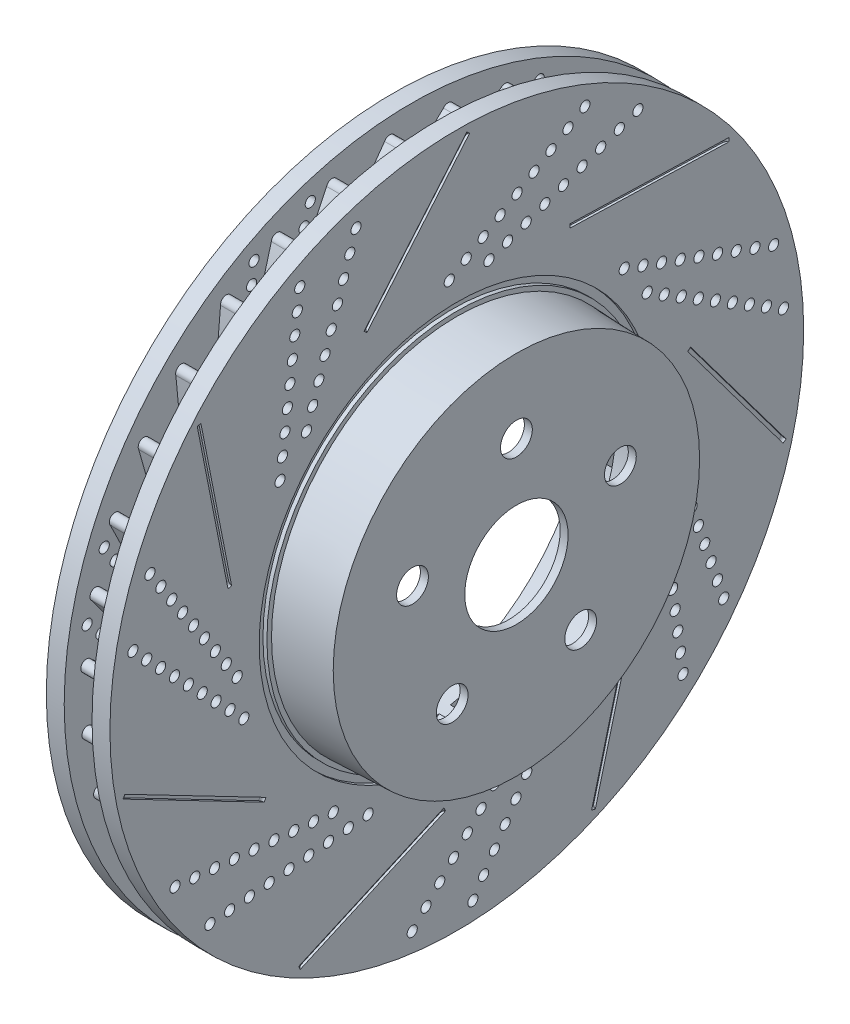
from build123d import *

# Parameters (mm, degrees)
SKETCH1_R                = 87.27
BOSS_EXTRUDE1_DEPTH      = 4.5
SKETCH2_R                = 49.72
CUT_EXTRUDE1_DEPTH       = 4.5
SKETCH3_R                = 1.28
CUT_EXTRUDE2_DEPTH       = 4.5
CIRPATTERN1_COUNT        = 7
CUT_EXTRUDE3_DEPTH       = 0.6
FILLET1_R                = 1
CIRPATTERN2_COUNT        = 7
FILLET1_OF_CIRPATTERN2_R = 1
BOSS_EXTRUDE2_START      = 7
BOSS_EXTRUDE2_DEPTH      = 7
SKETCH9_R                = 13
SKETCH9_R_2              = 4
CUT_EXTRUDE4_DEPTH       = 4.6
SCALE1_SCALE             = 2


with BuildPart() as part:
    # Sketch1 → Boss-Extrude1 (new body)
    with BuildSketch(Plane(origin=(0, 0, 0), x_dir=(0, 0, -1), z_dir=(1, 0, 0))):
        Circle(SKETCH1_R)
    extrude(amount=BOSS_EXTRUDE1_DEPTH)

    # Sketch2 → Cut-Extrude1 (cut)
    with BuildSketch(Plane(origin=(4.5, 0, 0), x_dir=(0, 0, -1), z_dir=(1, 0, 0))):
        Circle(SKETCH2_R)
    extrude(amount=-CUT_EXTRUDE1_DEPTH, mode=Mode.SUBTRACT)

    # Sketch3 → Cut-Extrude2 (cut)
    with BuildSketch(Plane(origin=(4.5, 0, 0), x_dir=(0, 0, -1), z_dir=(1, 0, 0))):
        with Locations((-22.32, -50.721196999)):
            Circle(SKETCH3_R)
        with Locations((-31.072217933, -45.883978661)):
            Circle(SKETCH3_R)
        with Locations((-27.295191101, -51.21866409)):
            Circle(SKETCH3_R)
        with Locations((-32.270382202, -51.716131181)):
            Circle(SKETCH3_R)
        with Locations((-37.245573304, -52.213598272)):
            Circle(SKETCH3_R)
        with Locations((-42.220764405, -52.711065363)):
            Circle(SKETCH3_R)
        with Locations((-47.195955506, -53.208532454)):
            Circle(SKETCH3_R)
        with Locations((-52.171146607, -53.705999545)):
            Circle(SKETCH3_R)
        with Locations((-57.146337708, -54.203466636)):
            Circle(SKETCH3_R)
        with Locations((-62.12152881, -54.700933726)):
            Circle(SKETCH3_R)
        with Locations((-36.050921957, -45.422994664)):
            Circle(SKETCH3_R)
        with Locations((-41.02962598, -44.962010668)):
            Circle(SKETCH3_R)
        with Locations((-46.008330004, -44.501026671)):
            Circle(SKETCH3_R)
        with Locations((-50.987034028, -44.040042675)):
            Circle(SKETCH3_R)
        with Locations((-55.965738051, -43.579058678)):
            Circle(SKETCH3_R)
        with Locations((-60.944442075, -43.118074682)):
            Circle(SKETCH3_R)
        with Locations((-65.923146098, -42.657090685)):
            Circle(SKETCH3_R)
        with Locations((-70.901850122, -42.196106689)):
            Circle(SKETCH3_R)
    cut_extrude2 = extrude(amount=-CUT_EXTRUDE2_DEPTH, mode=Mode.SUBTRACT)

    # CirPattern1: Cut-Extrude2 ×7 about axis
    cirpattern1_axis = Axis((0, 0, 0), (1, 0, 0))
    for i in range(1, CIRPATTERN1_COUNT):
        add(cut_extrude2.rotate(cirpattern1_axis, i * 360 / CIRPATTERN1_COUNT), mode=Mode.SUBTRACT)

    # Sketch4 → Cut-Extrude3 (cut)
    with BuildSketch(Plane(origin=(4.5, 0, 0), x_dir=(0, 0, -1), z_dir=(1, 0, 0))):
        Polygon((-3.222332444, -58.840115094), (-2.84, -59.698847824), (-39.381818306, -75.968313547), (-39.76415075, -75.109580817), align=None)
    cut_extrude3 = extrude(amount=-CUT_EXTRUDE3_DEPTH, mode=Mode.SUBTRACT)

    # Fillet1
    # the kernel refuses this fillet: 1 mm, written as the material it adds along each edge
    with BuildSketch(Plane(origin=(3.9, -56.746919489, 4.154283172), x_dir=(1, 0, 0), z_dir=(0, -0.9135454576426023, -0.40673664307579704)), Plane(origin=(3.9, -78.061509153, 38.449867578), x_dir=(1, 0, 0), z_dir=(0, 0.9135454576426025, 0.40673664307579666))) as fillet1_piece_1:
        with BuildLine():
            CenterArc((1, 0.916515139), FILLET1_R, 180, 66.421821522)
            Line((0, 0.916515139), (-0.02, 0.916515139))
            Line((-0.02, 0.916515139), (-0.02, 0))
            Line((-0.02, 0), (0, -0.02))
            ThreePointArc((0, -0.02), (0.3, -0.02), (0.592, -0.018330303))
            Line((0.592, -0.018330303), (0.6, 0))
        make_face()
    extrude(amount=5.522575695)

    # CirPattern2: Cut-Extrude3 ×7 about axis
    cirpattern2_axis = Axis((0, 0, 0), (1, 0, 0))
    for i in range(1, CIRPATTERN2_COUNT):
        add(cut_extrude3.rotate(cirpattern2_axis, i * 360 / CIRPATTERN2_COUNT), mode=Mode.SUBTRACT)

    # Fillet1 of CirPattern2
    # the kernel refuses this fillet: 1 mm, written as the material it adds along each edge
    with BuildSketch(Plane(origin=(3.9, -38.629074959, -41.776374998), x_dir=(1, 0, 0), z_dir=(0, -0.251586763744512, -0.9678347484506656)), Plane(origin=(3.9, -78.731871844, -37.057845107), x_dir=(1, 0, 0), z_dir=(0, 0.25158676374451233, 0.9678347484506655)), Plane(origin=(3.9, 8.577250904, -56.248570711), x_dir=(1, 0, 0), z_dir=(0, 0.5998218946879109, -0.8001335480112084)), Plane(origin=(3.9, -20.115529199, -84.660244584), x_dir=(1, 0, 0), z_dir=(0, -0.5998218946879105, 0.8001335480112088)), Plane(origin=(3.9, 49.324731893, -28.364445418), x_dir=(1, 0, 0), z_dir=(0, 0.9995524322835033, -0.029915466169402057)), Plane(origin=(3.9, 53.648217214, -68.511753135), x_dir=(1, 0, 0), z_dir=(0, -0.9995524322835032, 0.029915466169402497)), Plane(origin=(3.9, 52.929683725, 20.878685805), x_dir=(1, 0, 0), z_dir=(0, 0.6465996012158023, 0.7628295718622643)), Plane(origin=(3.9, 87.013761841, -0.772514191), x_dir=(1, 0, 0), z_dir=(0, -0.6465996012158027, -0.762829571862264)), Plane(origin=(3.9, 16.677504143, 54.399740769), x_dir=(1, 0, 0), z_dir=(0, -0.1932559177955506, 0.9811483833941732)), Plane(origin=(3.9, 54.856169044, 67.548443696), x_dir=(1, 0, 0), z_dir=(0, 0.19325591779555018, -0.9811483833941733)), Plane(origin=(3.9, -32.133176217, 46.956681381), x_dir=(1, 0, 0), z_dir=(0, -0.8875857890045524, 0.46064245045063557)), Plane(origin=(3.9, -18.609237905, 85.004045742), x_dir=(1, 0, 0), z_dir=(0, 0.8875857890045522, -0.460642450450636))) as fillet1_of_cirpattern2_piece_1:
        with BuildLine():
            CenterArc((1, 0.916515139), FILLET1_OF_CIRPATTERN2_R, 180, 66.421821522)
            Line((0, 0.916515139), (-0.02, 0.916515139))
            Line((-0.02, 0.916515139), (-0.02, 0))
            Line((-0.02, 0), (0, -0.02))
            ThreePointArc((0, -0.02), (0.3, -0.02), (0.592, -0.018330303))
            Line((0.592, -0.018330303), (0.6, 0))
        make_face()
    extrude(amount=5.522575695)


with BuildPart() as body_2:
    # Mirror2: mirrored copy
    add(part.part.mirror(Plane.ZY.offset(3.5)))


with BuildPart() as part_1:
    add(part.part)

    add(body_2.part)  # Boss-Extrude2 merges body 2
    # Sketch6 → Boss-Extrude2 (add)
    with BuildSketch(Plane(origin=(-7, 0, 0), x_dir=(0, 0, -1), z_dir=(1, 0, 0)).offset(BOSS_EXTRUDE2_START)):
        with BuildLine():
            ThreePointArc((-65.408487578, -48.075985448), (-66.633737197, -49.682988582), (-65.026734063, -50.9082382))
            add(Edge.make_bspline(
                [(-16.507092101, -46.899832733), (-40.460677436, -52.432931171), (-65.026734063, -50.9082382)],
                knots=[0, 0, 0, 1, 1, 1], degree=2))
            ThreePointArc((-16.507092101, -46.899832733), (-17.860913713, -46.401143966), (-19.199696195, -45.863384808))
            add(Edge.make_bspline(
                [(-19.199696195, -45.863384808), (-36.541787122, -49.271282557), (-43.651321864, -48.455688055), (-65.408487578, -48.075985448)],
                knots=[0, 0, 0, 0, 1, 1, 1, 1], degree=3))
        make_face()
        with BuildLine():
            ThreePointArc((-72.94164495, -35.624248148), (-74.434145792, -36.986649313), (-73.071744627, -38.479150155))
            add(Edge.make_bspline(
                [(-24.616104839, -43.198678018), (-49.172719079, -44.365779472), (-73.071744627, -38.479150155)],
                knots=[0, 0, 0, 1, 1, 1], degree=2))
            ThreePointArc((-24.616104839, -43.198678018), (-25.859125664, -42.466269202), (-27.080372754, -41.698103212))
            add(Edge.make_bspline(
                [(-27.080372754, -41.698103212), (-44.752272786, -41.954684737), (-51.601924358, -39.882740727), (-72.94164495, -35.624248148)],
                knots=[0, 0, 0, 0, 1, 1, 1, 1], degree=3))
        make_face()
        with BuildLine():
            ThreePointArc((-78.130397836, -22.027518201), (-79.842179697, -23.101528702), (-78.768169196, -24.813310564))
            add(Edge.make_bspline(
                [(-31.933935714, -38.109082249), (-56.304309072, -34.872675116), (-78.768169196, -24.813310564)],
                knots=[0, 0, 0, 1, 1, 1], degree=2))
            ThreePointArc((-31.933935714, -38.109082249), (-33.026204038, -37.166493604), (-34.090663852, -36.19261027))
            add(Edge.make_bspline(
                [(-34.090663852, -36.19261027), (-51.52438358, -33.289628829), (-57.893998545, -30.027929297), (-78.130397836, -22.027518201)],
                knots=[0, 0, 0, 0, 1, 1, 1, 1], degree=3))
        make_face()
        with BuildLine():
            ThreePointArc((-80.80797545, -7.722805694), (-82.684020253, -8.473905951), (-81.932919995, -10.349950754))
            add(Edge.make_bspline(
                [(-38.225383619, -31.794629219), (-61.626232243, -24.258734289), (-81.932919995, -10.349950754)],
                knots=[0, 0, 0, 1, 1, 1], degree=2))
            ThreePointArc((-38.225383619, -31.794629219), (-39.131793041, -30.672156322), (-40.005252963, -29.523857054))
            add(Edge.make_bspline(
                [(-40.005252963, -29.523857054), (-56.640458291, -23.55461686), (-62.325311983, -19.207995512), (-80.80797545, -7.722805694)],
                knots=[0, 0, 0, 0, 1, 1, 1, 1], degree=3))
        make_face()
        with BuildLine():
            ThreePointArc((-80.888318244, 6.830124142), (-82.868328364, 6.426075109), (-82.464279332, 4.446064989))
            add(Edge.make_bspline(
                [(-43.288236243, -24.458270646), (-64.967437605, -12.865097781), (-82.464279332, 4.446064989)],
                knots=[0, 0, 0, 1, 1, 1], degree=2))
            ThreePointArc((-43.288236243, -24.458270646), (-43.979654017, -23.191990698), (-44.634040328, -21.90618278))
            add(Edge.make_bspline(
                [(-44.634040328, -21.90618278), (-59.936062069, -13.062540124), (-64.753438613, -7.770700947), (-80.888318244, 6.830124142)],
                knots=[0, 0, 0, 0, 1, 1, 1, 1], degree=3))
        make_face()
        with BuildLine():
            ThreePointArc((-78.368843934, 21.163528168), (-80.389180218, 21.119516828), (-80.345168878, 19.099180544))
            add(Edge.make_bspline(
                [(-46.959769336, -16.335803129), (-66.220536066, -1.057966445), (-80.345168878, 19.099180544)],
                knots=[0, 0, 0, 1, 1, 1], degree=2))
            ThreePointArc((-46.959769336, -16.335803129), (-47.413972727, -14.96641541), (-47.828252912, -13.584425767))
            add(Edge.make_bspline(
                [(-47.828252912, -13.584425767), (-61.305271497, -2.150622601), (-65.100336446, 3.91635034), (-78.368843934, 21.163528168)],
                knots=[0, 0, 0, 0, 1, 1, 1, 1], degree=3))
        make_face()
        with BuildLine():
            ThreePointArc((-73.330530499, 34.816718986), (-75.326257675, 35.134159899), (-75.643698589, 33.138432723))
            add(Edge.make_bspline(
                [(-49.121976805, -7.688289459), (-65.345252011, 10.783168803), (-75.643698589, 33.138432723)],
                knots=[0, 0, 0, 1, 1, 1], degree=2))
            ThreePointArc((-49.121976805, -7.688289459), (-49.324367341, -6.259807217), (-49.485226093, -4.826054133))
            add(Edge.make_bspline(
                [(-49.485226093, -4.826054133), (-60.704079056, 8.830417702), (-63.354855901, 15.477526905), (-73.330530499, 34.816718986)],
                knots=[0, 0, 0, 0, 1, 1, 1, 1], degree=3))
        make_face()
        with BuildLine():
            ThreePointArc((-65.935313476, 47.350871808), (-67.842287232, 48.019562163), (-68.510977588, 46.112588407))
            add(Edge.make_bspline(
                [(-49.705363521, 1.20633216), (-62.369717791, 22.277724133), (-68.510977588, 46.112588407)],
                knots=[0, 0, 0, 1, 1, 1], degree=2))
            ThreePointArc((-49.705363521, 1.20633216), (-49.649436205, 2.64799633), (-49.551703392, 4.087430852))
            add(Edge.make_bspline(
                [(-49.551703392, 4.087430852), (-58.151807567, 19.527641115), (-59.573098159, 26.541243021), (-65.935313476, 47.350871808)],
                knots=[0, 0, 0, 0, 1, 1, 1, 1], degree=3))
        make_face()
        with BuildLine():
            ThreePointArc((-56.420881227, 58.363128649), (-58.177809857, 59.361576188), (-59.176257395, 57.604647558))
            add(Edge.make_bspline(
                [(-48.691178955, 10.062181271), (-57.389569522, 33.056255079), (-59.176257395, 57.604647558)],
                knots=[0, 0, 0, 1, 1, 1], degree=2))
            ThreePointArc((-48.691178955, 10.062181271), (-48.378731337, 11.470691097), (-48.025548172, 12.869542446))
            add(Edge.make_bspline(
                [(-48.025548172, 12.869542446), (-53.730489136, 29.597230075), (-53.876612026, 36.751901747), (-56.420881227, 58.363128649)],
                knots=[0, 0, 0, 0, 1, 1, 1, 1], degree=3))
        make_face()
        with BuildLine():
            ThreePointArc((-45.093035431, 67.499546515), (-46.643449803, 68.795660311), (-47.9395636, 67.245245939))
            add(Edge.make_bspline(
                [(-46.112019835, 18.594623597), (-50.564873269, 42.772330788), (-47.9395636, 67.245245939)],
                knots=[0, 0, 0, 1, 1, 1], degree=2))
            ThreePointArc((-46.112019835, 18.594623597), (-45.553094238, 19.924708414), (-44.955812319, 21.238016357))
            add(Edge.make_bspline(
                [(-44.955812319, 21.238016357), (-47.582228574, 38.715539707), (-46.448487252, 45.781324112), (-45.093035431, 67.499546515)],
                knots=[0, 0, 0, 0, 1, 1, 1, 1], degree=3))
        make_face()
        with BuildLine():
            ThreePointArc((-32.315862375, 74.466473417), (-33.609930895, 76.018595307), (-35.162052785, 74.724526787))
            add(Edge.make_bspline(
                [(-42.050782457, 26.52941942), (-42.114980385, 51.113668593), (-35.162052785, 74.724526787)],
                knots=[0, 0, 0, 1, 1, 1], degree=2))
            ThreePointArc((-42.050782457, 26.52941942), (-41.263343209, 27.738329208), (-40.441159667, 28.923882948))
            add(Edge.make_bspline(
                [(-40.441159667, 28.923882948), (-39.904636034, 46.589500038), (-37.527469879, 53.33929705), (-32.315862375, 74.466473417)],
                knots=[0, 0, 0, 0, 1, 1, 1, 1], degree=3))
        make_face()
        with BuildLine():
            ThreePointArc((-18.500030912, 79.039986592), (-19.496161153, 80.798230101), (-21.254404663, 79.80209986))
            add(Edge.make_bspline(
                [(-36.63799833, 33.611537875), (-32.311477378, 57.812171032), (-21.254404663, 79.80209986)],
                knots=[0, 0, 0, 1, 1, 1], degree=2))
            ThreePointArc((-36.63799833, 33.611537875), (-35.647354377, 34.660417279), (-34.626694869, 35.680112142))
            add(Edge.make_bspline(
                [(-34.626694869, 35.680112142), (-30.94447566, 52.966035504), (-27.400288747, 59.182901094), (-18.500030912, 79.039986592)],
                knots=[0, 0, 0, 0, 1, 1, 1, 1], degree=3))
        make_face()
        with BuildLine():
            ThreePointArc((-4.089593233, 81.073089563), (-4.755768751, 82.980943299), (-6.663622487, 82.314767782))
            add(Edge.make_bspline(
                [(-30.047638792, 39.613353847), (-21.469456902, 62.652542727), (-6.663622487, 82.314767782)],
                knots=[0, 0, 0, 1, 1, 1], degree=2))
            ThreePointArc((-30.047638792, 39.613353847), (-28.885630245, 40.468491019), (-27.699299607, 41.289553174))
            add(Edge.make_bspline(
                [(-27.699299607, 41.289553174), (-20.989734376, 57.640199008), (-16.39243979, 63.124318001), (-4.089593233, 81.073089563)],
                knots=[0, 0, 0, 0, 1, 1, 1, 1], degree=3))
        make_face()
        with BuildLine():
            ThreePointArc((10.452287337, 80.500436729), (10.137477973, 82.496580702), (8.141333999, 82.181771338))
            add(Edge.make_bspline(
                [(-22.491523419, 44.341964033), (-9.937390417, 65.479210147), (8.141333999, 82.181771338)],
                knots=[0, 0, 0, 1, 1, 1], degree=2))
            ThreePointArc((-22.491523419, 44.341964033), (-21.19549819, 44.97587416), (-19.881626065, 45.571913993))
            add(Edge.make_bspline(
                [(-19.881626065, 45.571913993), (-10.360365759, 60.461759089), (-4.85772433, 65.036867388), (10.452287337, 80.500436729)],
                knots=[0, 0, 0, 0, 1, 1, 1, 1], degree=3))
        make_face()
        with BuildLine():
            ThreePointArc((24.658222791, 77.340433622), (24.704897813, 79.360710123), (22.684621312, 79.407385145))
            add(Edge.make_bspline(
                [(-14.212511978, 47.645387009), (1.914071973, 66.201321877), (22.684621312, 79.407385145)],
                knots=[0, 0, 0, 1, 1, 1], degree=2))
            ThreePointArc((-14.212511978, 47.645387009), (-12.824125383, 48.0376957), (-11.424940702, 48.389556001))
            add(Edge.make_bspline(
                [(-11.424940702, 48.389556001), (0.601993538, 61.340028486), (6.833122386, 64.859078345), (24.658222791, 77.340433622)],
                knots=[0, 0, 0, 0, 1, 1, 1, 1], degree=3))
        make_face()
        with BuildLine():
            ThreePointArc((38.071622677, 71.694645343), (38.47828191, 73.674121023), (36.49880623, 74.080780256))
            add(Edge.make_bspline(
                [(-5.476698707, 49.417448045), (13.704014515, 64.795668651), (36.49880623, 74.080780256)],
                knots=[0, 0, 0, 1, 1, 1], degree=2))
            ThreePointArc((-5.476698707, 49.417448045), (-4.040574635, 49.555546174), (-2.601048344, 49.651917863))
            add(Edge.make_bspline(
                [(-2.601048344, 49.651917863), (11.545004268, 60.246778896), (18.304346927, 62.596665158), (38.071622677, 71.694645343)],
                knots=[0, 0, 0, 0, 1, 1, 1, 1], degree=3))
        make_face()
        with BuildLine():
            ThreePointArc((50.261369284, 63.744532172), (51.014942366, 65.619585053), (49.139889485, 66.373158136))
            add(Edge.make_bspline(
                [(3.435140166, 49.601191639), (25.053498755, 61.307429321), (49.139889485, 66.373158136)],
                knots=[0, 0, 0, 1, 1, 1], degree=2))
            ThreePointArc((3.435140166, 49.601191639), (4.872843506, 49.48064062), (6.306443847, 49.318426232))
            add(Edge.make_bspline(
                [(6.306443847, 49.318426232), (22.116949061, 57.217148261), (29.187254697, 58.322343648), (50.261369284, 63.744532172)],
                knots=[0, 0, 0, 0, 1, 1, 1, 1], degree=3))
        make_face()
        with BuildLine():
            ThreePointArc((60.835674127, 53.745617288), (61.9119406, 55.455981628), (60.20157626, 56.532248102))
            add(Edge.make_bspline(
                [(12.236570807, 48.190712123), (35.59774293, 55.848718768), (60.20157626, 56.532248102)],
                knots=[0, 0, 0, 1, 1, 1], degree=2))
            ThreePointArc((12.236570807, 48.190712123), (13.629644448, 47.815386563), (15.011241744, 47.399799802))
            add(Edge.make_bspline(
                [(15.011241744, 47.399799802), (31.978036913, 52.348511402), (39.132060086, 52.173494025), (60.835674127, 53.745617288)],
                knots=[0, 0, 0, 0, 1, 1, 1, 1], degree=3))
        make_face()
        with BuildLine():
            ThreePointArc((69.454670348, 42.019274042), (70.819038121, 43.509977324), (69.328334839, 44.874345098))
            add(Edge.make_bspline(
                [(20.644707995, 45.231343467), (44.997846358, 48.594984442), (69.328334839, 44.874345098)],
                knots=[0, 0, 0, 1, 1, 1], degree=2))
            ThreePointArc((20.644707995, 45.231343467), (21.948377403, 44.61330664), (23.233565981, 43.957704806))
            add(Edge.make_bspline(
                [(23.233565981, 43.957704806), (40.811324348, 45.797350315), (47.819128865, 44.347745376), (69.454670348, 42.019274042)],
                knots=[0, 0, 0, 0, 1, 1, 1, 1], degree=3))
        make_face()
        with BuildLine():
            ThreePointArc((75.841336316, 28.942396755), (77.449953488, 30.165526549), (76.226823693, 31.774143721))
            add(Edge.make_bspline(
                [(28.389307281, 40.818202215), (52.95168198, 39.779367332), (76.226823693, 31.774143721)],
                knots=[0, 0, 0, 1, 1, 1], degree=2))
            ThreePointArc((28.389307281, 40.818202215), (29.561671449, 39.977318334), (30.70914429, 39.102773009))
            add(Edge.make_bspline(
                [(30.70914429, 39.102773009), (48.332902238, 37.774224706), (54.969251497, 35.096623701), (75.841336316, 28.942396755)],
                knots=[0, 0, 0, 0, 1, 1, 1, 1], degree=3))
        make_face()
        with BuildLine():
            ThreePointArc((79.790399333, 14.935287022), (81.591563623, 15.85153093), (80.675319715, 17.65269522))
            add(Edge.make_bspline(
                [(35.221450873, 35.093130359), (59.203606974, 29.685208625), (80.675319715, 17.65269522)],
                knots=[0, 0, 0, 1, 1, 1], degree=2))
            ThreePointArc((35.221450873, 35.093130359), (36.224829051, 34.056426122), (37.197705434, 32.991045914))
            add(Edge.make_bspline(
                [(37.197705434, 32.991045914), (54.301020881, 28.537004434), (60.352617157, 24.717467663), (79.790399333, 14.935287022)],
                knots=[0, 0, 0, 0, 1, 1, 1, 1], degree=3))
        make_face()
        with BuildLine():
            ThreePointArc((81.174933263, 0.448144876), (83.110753769, 1.028054065), (82.53084458, 2.96387457))
            add(Edge.make_bspline(
                [(40.921548053, 28.240136419), (63.552679327, 18.636942888), (82.53084458, 2.96387457)],
                knots=[0, 0, 0, 1, 1, 1], degree=2))
            ThreePointArc((40.921548053, 28.240136419), (41.723690842, 27.040932354), (42.490701719, 25.818959457))
            add(Edge.make_bspline(
                [(42.490701719, 25.818959457), (58.523860035, 18.38258136), (63.796200043, 13.543871876), (81.174933263, 0.448144876)],
                knots=[0, 0, 0, 0, 1, 1, 1, 1], degree=3))
        make_face()
        with BuildLine():
            ThreePointArc((79.950438048, -14.053401016), (81.958695905, -13.828465304), (81.733760194, -11.820207447))
            add(Edge.make_bspline(
                [(45.306393008, 20.479481258), (65.859116275, 6.989670471), (81.733760194, -11.820207447)],
                knots=[0, 0, 0, 1, 1, 1], degree=2))
            ThreePointArc((45.306393008, 20.479481258), (45.881518878, 19.15632077), (46.418011889, 17.8170304))
            add(Edge.make_bspline(
                [(46.418011889, 17.8170304), (60.865694173, 7.637326995), (65.189320569, 1.934964903), (79.950438048, -14.053401016)],
                knots=[0, 0, 0, 0, 1, 1, 1, 1], degree=3))
        make_face()
        with BuildLine():
            ThreePointArc((76.15626997, -28.103259035), (78.17241812, -28.240526421), (78.309685505, -26.224378271))
            add(Edge.make_bspline(
                [(48.235053214, 12.060598719), (66.048787037, -4.882255705), (78.309685505, -26.224378271)],
                knots=[0, 0, 0, 1, 1, 1], degree=2))
            ThreePointArc((48.235053214, 12.060598719), (48.564677147, 10.656009274), (48.853408964, 9.242447326))
            add(Edge.make_bspline(
                [(48.853408964, 9.242447326), (61.251254821, -3.353397343), (64.487202693, -9.736133433), (76.15626997, -28.103259035)],
                knots=[0, 0, 0, 0, 1, 1, 1, 1], degree=3))
        make_face()
        with BuildLine():
            ThreePointArc((69.914376713, -41.249855186), (71.873614495, -41.744913781), (72.36867309, -39.785675999))
            add(Edge.make_bspline(
                [(49.613399121, 3.254078613), (64.115595438, -16.597262166), (72.36867309, -39.785675999)],
                knots=[0, 0, 0, 1, 1, 1], degree=2))
            ThreePointArc((49.613399121, 3.254078613), (49.686926732, 1.813204873), (49.718617279, 0.37080439))
            add(Edge.make_bspline(
                [(49.718617279, 0.37080439), (59.66814974, -14.236340731), (61.712413062, -21.094304431), (69.914376713, -41.249855186)],
                knots=[0, 0, 0, 0, 1, 1, 1, 1], degree=3))
        make_face()
        with BuildLine():
            ThreePointArc((61.425377864, -53.070647051), (63.264733763, -53.907585265), (64.101671977, -52.068229366))
            add(Edge.make_bspline(
                [(49.397129559, -5.657030256), (60.121675848, -27.778818964), (64.101671977, -52.068229366)],
                knots=[0, 0, 0, 1, 1, 1], degree=2))
            ThreePointArc((49.397129559, -5.657030256), (49.21219761, -7.087877424), (48.985828325, -8.512756504))
            add(Edge.make_bspline(
                [(48.985828325, -8.512756504), (56.167261232, -24.661716415), (56.954135698, -31.774487127), (61.425377864, -53.070647051)],
                knots=[0, 0, 0, 0, 1, 1, 1, 1], degree=3))
        make_face()
        with BuildLine():
            ThreePointArc((50.962116829, -63.185704653), (52.622472433, -64.337622603), (53.774390384, -62.677266999))
            add(Edge.make_bspline(
                [(47.593195609, -14.386317519), (54.195396127, -38.067541665), (53.774390384, -62.677266999)],
                knots=[0, 0, 0, 1, 1, 1], degree=2))
            ThreePointArc((47.593195609, -14.386317519), (47.155747965, -15.76114951), (46.678594544, -17.1227104))
            add(Edge.make_bspline(
                [(46.678594544, -17.1227104), (50.861110733, -34.294444241), (50.365305552, -41.433411663), (50.962116829, -63.185704653)],
                knots=[0, 0, 0, 0, 1, 1, 1, 1], degree=3))
        make_face()
        with BuildLine():
            ThreePointArc((38.860891427, -71.269921717), (40.288881541, -72.699795814), (41.718755638, -71.271805699))
            add(Edge.make_bspline(
                [(44.259577192, -22.653216699), (46.527231783, -47.132742254), (41.718755638, -71.271805699)],
                knots=[0, 0, 0, 1, 1, 1], degree=2))
            ThreePointArc((44.259577192, -22.653216699), (43.58367378, -23.927845281), (42.871072326, -25.182326294))
            add(Edge.make_bspline(
                [(42.871072326, -25.182326294), (43.920242287, -42.824920412), (42.157693043, -49.760632257), (38.860891427, -71.269921717)],
                knots=[0, 0, 0, 0, 1, 1, 1, 1], degree=3))
        make_face()
        with BuildLine():
            ThreePointArc((25.510645, -77.063464857), (26.660372847, -78.725337769), (28.322245759, -77.575609922))
            add(Edge.make_bspline(
                [(39.503419547, -30.192022856), (37.363643927, -54.683057726), (28.322245759, -77.575609922)],
                knots=[0, 0, 0, 1, 1, 1], degree=2))
            ThreePointArc((39.503419547, -30.192022856), (38.61078446, -31.325480418), (37.68563857, -32.432561502))
            add(Edge.make_bspline(
                [(37.68563857, -32.432561502), (35.567741116, -49.978968404), (32.595097593, -56.488505187), (25.510645, -77.063464857)],
                knots=[0, 0, 0, 0, 1, 1, 1, 1], degree=3))
        make_face()
        with BuildLine():
            ThreePointArc((11.340465452, -80.380124828), (12.174977833, -82.220582593), (14.015435598, -81.386070212))
            add(Edge.make_bspline(
                [(33.477589494, -36.760432555), (26.999157812, -60.47581473), (14.015435598, -81.386070212)],
                knots=[0, 0, 0, 1, 1, 1], degree=2))
            ThreePointArc((33.477589494, -36.760432555), (32.396912757, -37.716288839), (31.288957382, -38.640387498))
            add(Edge.make_bspline(
                [(31.288957382, -38.640387498), (26.07206348, -55.526651229), (21.984868888, -61.400791081), (11.340465452, -80.380124828)],
                knots=[0, 0, 0, 0, 1, 1, 1, 1], degree=3))
        make_face()
        with BuildLine():
            ThreePointArc((-3.194205986, -81.113301451), (-2.701730986, -83.073190241), (-0.741842195, -82.580715241))
            add(Edge.make_bspline(
                [(26.37576217, -42.147331706), (15.76689655, -64.324829288), (-0.741842195, -82.580715241)],
                knots=[0, 0, 0, 1, 1, 1], degree=2))
            ThreePointArc((26.37576217, -42.147331706), (25.141777623, -42.894864704), (23.886623359, -43.606279645))
            add(Edge.make_bspline(
                [(23.886623359, -43.606279645), (15.738408272, -59.289661796), (10.668028406, -64.339605029), (-3.194205986, -81.113301451)],
                knots=[0, 0, 0, 0, 1, 1, 1, 1], degree=3))
        make_face()
        with BuildLine():
            ThreePointArc((-17.626213015, -79.239429824), (-17.491603948, -81.255757202), (-15.475276569, -81.121148135))
            add(Edge.make_bspline(
                [(18.426196147, -46.179580937), (4.02787426, -66.106390907), (-15.475276569, -81.121148135)],
                knots=[0, 0, 0, 1, 1, 1], degree=2))
            ThreePointArc((18.426196147, -46.179580937), (17.078565069, -46.694764323), (15.716553607, -47.170630086))
            add(Edge.make_bspline(
                [(15.716553607, -47.170630086), (4.898907672, -61.14705385), (-0.991691286, -65.210491133), (-17.626213015, -79.239429824)],
                knots=[0, 0, 0, 0, 1, 1, 1, 1], degree=3))
        make_face()
        with BuildLine():
            ThreePointArc((-31.491699056, -74.818737724), (-31.719282367, -76.82669727), (-29.711322822, -77.05428058))
            add(Edge.make_bspline(
                [(9.884397019, -48.72758044), (-7.840607223, -65.763238729), (-29.711322822, -77.05428058)],
                knots=[0, 0, 0, 1, 1, 1], degree=2))
            ThreePointArc((9.884397019, -48.72758044), (8.466433381, -48.993855796), (7.041340891, -49.218877663))
            add(Edge.make_bspline(
                [(7.041340891, -49.218877663), (-6.098047851, -61.03912928), (-12.619537204, -63.985458396), (-31.491699056, -74.818737724)],
                knots=[0, 0, 0, 0, 1, 1, 1, 1], degree=3))
        make_face()
        with BuildLine():
            ThreePointArc((-44.345015977, -67.993309833), (-44.927476952, -69.928364073), (-42.992422712, -70.510825048))
            add(Edge.make_bspline(
                [(1.024905238, -49.709435415), (-19.457085139, -63.306401949), (-42.992422712, -70.510825048)],
                knots=[0, 0, 0, 1, 1, 1], degree=2))
            ThreePointArc((1.024905238, -49.709435415), (-0.417816442, -49.718244432), (-1.860186315, -49.685190015))
            add(Edge.make_bspline(
                [(-1.860186315, -49.685190015), (-16.899007099, -58.969356872), (-23.841780812, -60.703880379), (-44.345015977, -67.993309833)],
                knots=[0, 0, 0, 0, 1, 1, 1, 1], degree=3))
        make_face()
        with BuildLine():
            ThreePointArc((-55.773047598, -58.982521019), (-56.691665461, -60.782475718), (-54.891710762, -61.701093582))
            add(Edge.make_bspline(
                [(-7.867527841, -49.093588234), (-30.448196329, -58.814845321), (-54.891710762, -61.701093582)],
                knots=[0, 0, 0, 1, 1, 1], degree=2))
            ThreePointArc((-7.867527841, -49.093588234), (-9.2886373, -48.844647784), (-10.701925602, -48.554579479))
            add(Edge.make_bspline(
                [(-10.701925602, -48.554579479), (-27.156818354, -55.004260815), (-34.297729969, -55.471229699), (-55.773047598, -58.982521019)],
                knots=[0, 0, 0, 0, 1, 1, 1, 1], degree=3))
        make_face()
    extrude(amount=-BOSS_EXTRUDE2_DEPTH)

    # Sketch8 → Revolve1 (revolve)
    with BuildSketch(Plane.XY, mode=Mode.PRIVATE) as revolve1_sk:
        Polygon((0, 51.77080439), (0, 44.77080439), (17.5, 44.159690924), (17.5, 0), (19.5, 0), (19.5, 46.091068474), (4.5, 46.614880016), (4.5, 47.77080439), (3.5, 47.77080439), (3.5, 51.77080439), align=None)
    revolve(revolve1_sk.sketch.rotate(Axis((0, 0, 0), (1, 0, 0)), 90), axis=Axis((0, 0, 0), (1, 0, 0)))

    # Sketch9 → Cut-Extrude4 (cut)
    with BuildSketch(Plane(origin=(19.5, 0, 0), x_dir=(0, 0, -1), z_dir=(1, 0, 0))):
        Circle(SKETCH9_R)
        with Locations((0, 27.5)):
            Circle(SKETCH9_R_2)
        with Locations((26.154054198, 8.497967345)):
            Circle(SKETCH9_R_2)
        with Locations((16.164094438, -22.247967345)):
            Circle(SKETCH9_R_2)
        with Locations((-16.164094438, -22.247967345)):
            Circle(SKETCH9_R_2)
        with Locations((-26.154054198, 8.497967345)):
            Circle(SKETCH9_R_2)
    extrude(amount=-CUT_EXTRUDE4_DEPTH, mode=Mode.SUBTRACT)


with BuildPart() as part_2:
    # Scale1: scaled about (-1.414964685, 0, 0)
    add(part_1.part.scale(SCALE1_SCALE).moved(Location((1.414964685, 0, 0))))


solid = part_2.part
